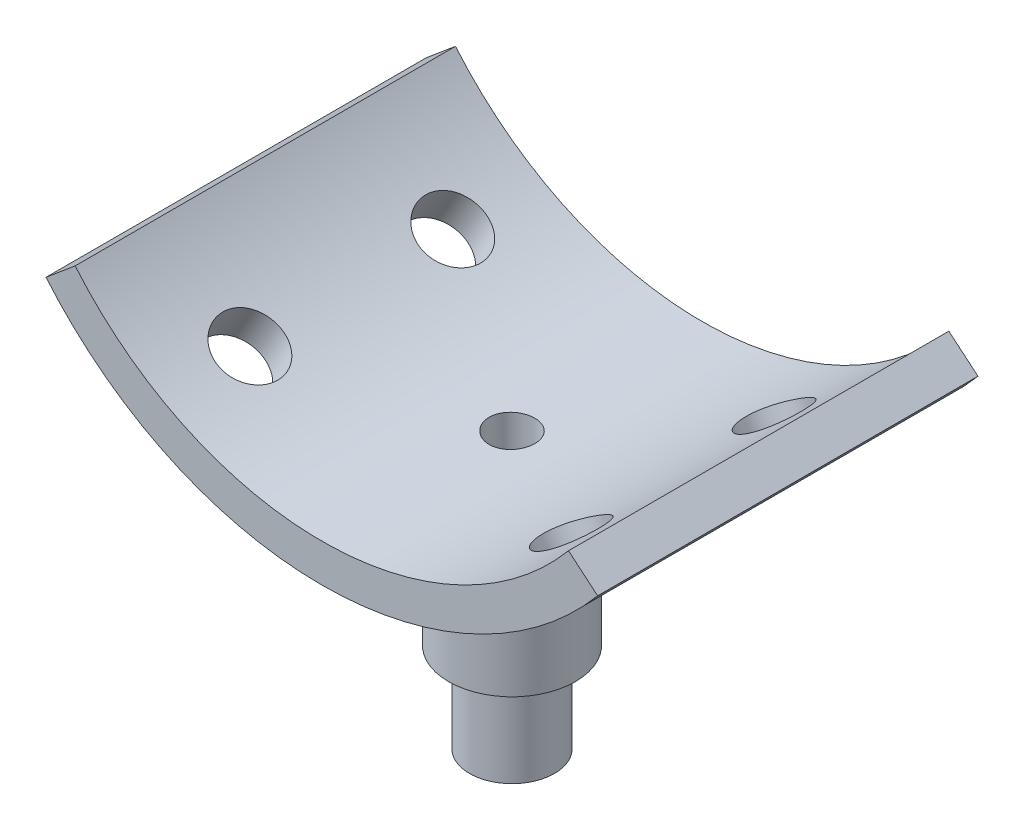
from build123d import *

# Parameters (mm, degrees)
BOSS_EXTRUDE1_DEPTH      = 15
BOSS_EXTRUDE2_REACH      = 37.479
BOSS_EXTRUDE2_END_RADIUS = 28.4
SKETCH2_R                = 5
SKETCH13_R               = 2.5
CUT_EXTRUDE2_DEPTH       = 42.894151609
SKETCH14_R               = 3.35
BOSS_EXTRUDE4_DEPTH      = 7.1
SKETCH15_R               = 1.8
CUT_EXTRUDE3_DEPTH       = 41.562277593


with BuildPart() as part:
    # Sketch1 → Boss-Extrude1 (new, symmetric)
    with BuildSketch(Plane.XY):
        with BuildLine():
            Line((21.755662185, -18.255168115), (19.457528855, -16.326805286))
            ThreePointArc((19.457528855, -16.326805286), (0, -25.4), (-19.457528855, -16.326805286))
            Line((-19.457528855, -16.326805286), (-21.755662185, -18.255168115))
            ThreePointArc((-21.755662185, -18.255168115), (0, -28.4), (21.755662185, -18.255168115))
        make_face()
    extrude(amount=BOSS_EXTRUDE1_DEPTH, both=True)

    # Boss-Extrude2: up to this cylinder (the profile starts outside it)
    boss_extrude2_end = Plane(origin=(0, 0, 0), z_dir=(0, 0, -1)) * Cylinder(BOSS_EXTRUDE2_END_RADIUS, 132.758, mode=Mode.PRIVATE)
    # Sketch2 → Boss-Extrude2 (add, up to the surface)
    with BuildSketch(Plane(origin=(0, -40, 0), x_dir=(1, 0, 0), z_dir=(0, 1, 0)), mode=Mode.PRIVATE) as boss_extrude2_sk1:
        Circle(SKETCH2_R)
    boss_extrude2_tool1 = extrude(boss_extrude2_sk1.sketch, amount=BOSS_EXTRUDE2_REACH, mode=Mode.PRIVATE) - boss_extrude2_end
    add(boss_extrude2_tool1.solids().sort_by_distance((0, -40, 0))[0])

    # Sketch13 → Cut-Extrude2 (cut, through all)
    with BuildSketch(Plane(origin=(14.2, -24.595121467, 0), x_dir=(-0.8660254037844379, -0.5000000000000014, 0), z_dir=(0.5000000000000014, -0.8660254037844379, 0))):
        with Locations((0, 8)):
            Circle(SKETCH13_R)
        with Locations((0, -8)):
            Circle(SKETCH13_R)
    cut_extrude2 = extrude(amount=-CUT_EXTRUDE2_DEPTH, mode=Mode.SUBTRACT)

    # Mirror1: Cut-Extrude2 across plane
    add(cut_extrude2.mirror(Plane(origin=(0, 0, 0), x_dir=(0, 0, 1), z_dir=(1, 0, 0))), mode=Mode.SUBTRACT)

    # Sketch14 → Boss-Extrude4 (add)
    with BuildSketch(Plane.XZ.offset(40)):
        Circle(SKETCH14_R)
    extrude(amount=BOSS_EXTRUDE4_DEPTH)

    # Sketch15 → Cut-Extrude3 (cut, through all)
    with BuildSketch(Plane.XZ.offset(47.1)):
        Circle(SKETCH15_R)
    extrude(amount=-CUT_EXTRUDE3_DEPTH, mode=Mode.SUBTRACT)


solid = part.part
